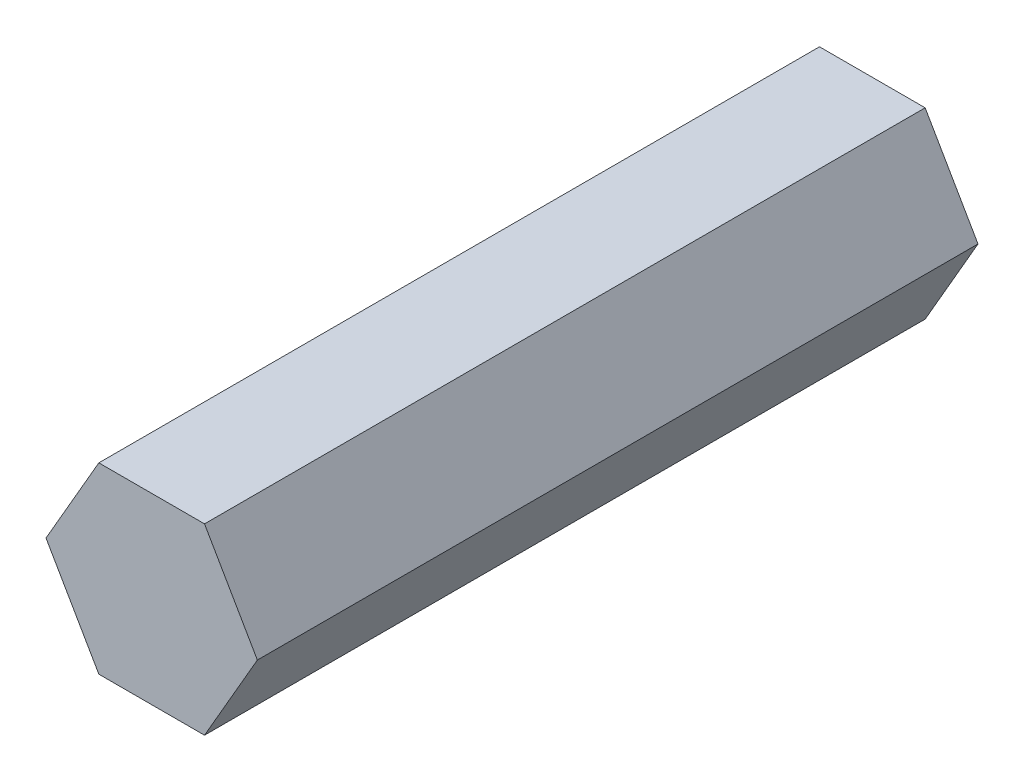
from build123d import *

# Parameters (mm, degrees)
BOSS_EXTRUDE1_DEPTH = 50


with BuildPart() as part:
    # Sketch1 → Boss-Extrude1 (new body)
    with BuildSketch(Plane.XY):
        Polygon((-7.332348419, 0), (-3.666174209, -6.35), (3.666174209, -6.35), (7.332348419, 0), (3.666174209, 6.35), (-3.666174209, 6.35), align=None)
    extrude(amount=BOSS_EXTRUDE1_DEPTH)


solid = part.part
